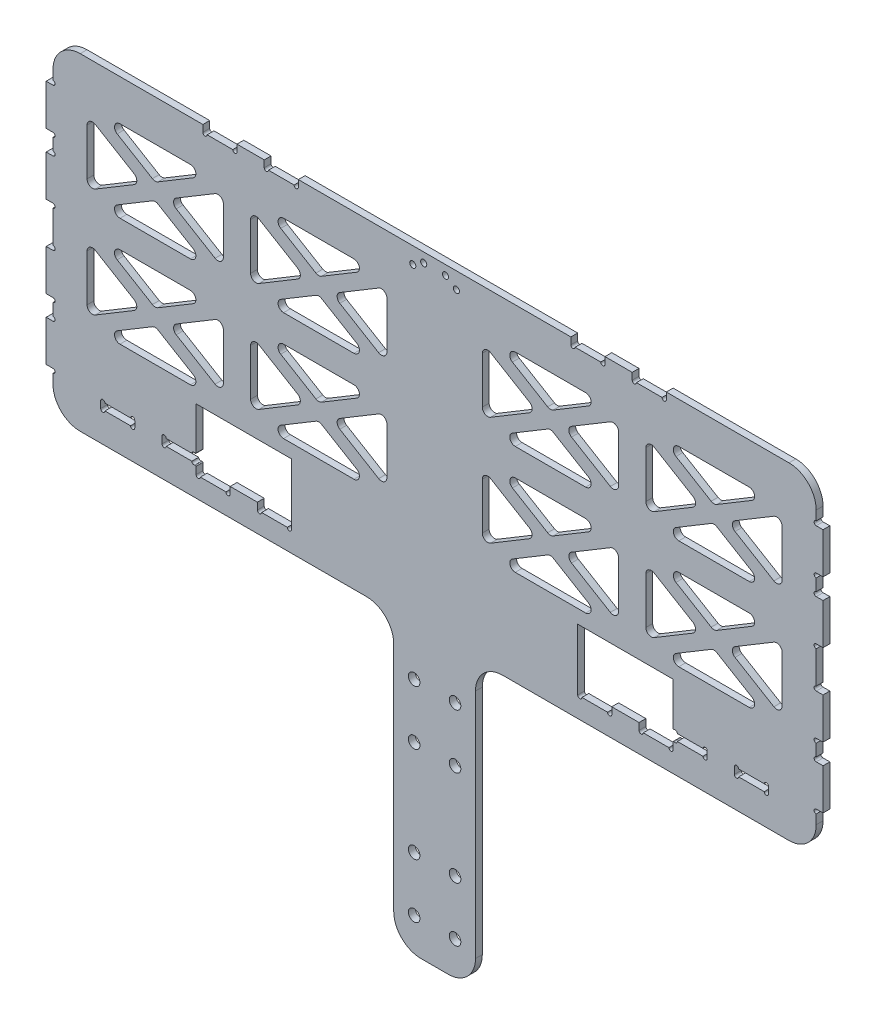
from build123d import *

# Parameters (mm, degrees)
EXTRUDE_1_DEPTH                = 5
SKETCH_2_R                     = 4.249999999999998
SKETCH_2_R_2                   = 4.249999999999999
CUT_EXTRUDE_1_DEPTH            = 26.000000000000004
FILLET_1_R                     = 20
SKETCH_3_W                     = 5.000000000000057
SKETCH_3_H                     = 30
SKETCH_3_H_2                   = 30.000000000000057
EXTRUDE_2_DEPTH                = 5
SKETCH_4_W                     = 70.00000000000001
SKETCH_4_H                     = 40.00000000000003
CUT_EXTRUDE_2_DEPTH            = 10
CUT_EXTRUDE_3_DEPTH            = 10
CUT_EXTRUDE_4_DEPTH            = 10
FILLET_2_R                     = 0.5
SKETCH_7_R                     = 2.2500000000000027
SKETCH_7_R_2                   = 2.2500000000000093
CUT_EXTRUDE_5_DEPTH            = 5
CUT_EXTRUDE_6_DEPTH            = 5
SKETCH_9_R                     = 1.5500000000000012
SKETCH_9_R_2                   = 1.5499999999999932
CUT_EXTRUDE_7_DEPTH            = 5
CUT_EXTRUDE_8_DEPTH            = 5
FILLET_3_R                     = 4
PATTERN_LINEAR_1_COUNT         = 2
PATTERN_LINEAR_1_PITCH         = 80
PATTERN_LINEAR_1_COUNT_DIR2    = 2
PATTERN_LINEAR_1_PITCH_DIR2    = 120
FILLET_3_OF_PATTERN_LINEAR_1_R = 4
MIRROR_1_DEPTH                 = 5


# Read off the part's stored shape, not the designer's step: 镜向1
with BuildPart() as part:
    # 草图1 → 凸台-拉伸1 (new body)
    with BuildSketch(Plane.XY):
        Polygon((-30, 0), (30, 0), (30, 210), (280, 210), (280, 449.99999999999994), (-280.0000000000001, 449.9999999999999), (-280, 210), (-30, 210), align=None)
    extrude(amount=EXTRUDE_1_DEPTH)

    # 草图2 → 切除-拉伸1 (cut)
    with BuildSketch(Plane.XY.offset(5)):
        with Locations((15, 25)):
            Circle(SKETCH_2_R)
        with Locations((15, 65)):
            Circle(SKETCH_2_R_2)
        with Locations((15, 135)):
            Circle(SKETCH_2_R_2)
        with Locations((15, 175.00000000000003)):
            Circle(SKETCH_2_R_2)
        with Locations(Location((-15, 175.00000000000003, 0), (0, 0, 180))):
            Circle(SKETCH_2_R_2)
        with Locations(Location((-15, 135, 0), (0, 0, 180))):
            Circle(SKETCH_2_R_2)
        with Locations(Location((-15, 65, 0), (0, 0, 180))):
            Circle(SKETCH_2_R_2)
        with Locations(Location((-15, 25, 0), (0, 0, 180))):
            Circle(SKETCH_2_R)
    extrude(amount=-CUT_EXTRUDE_1_DEPTH, mode=Mode.SUBTRACT)

    # 圆角1
    fillet_1_edges = [part.edges().sort_by_distance(p)[0] for p in [
        (30, 0, 2.5),
        (-30, 0, 2.5),
        (-30, 210, 2.5),
        (-280, 210, 2.5),
        (-280.0000000000001, 449.9999999999999, 2.5),
        (280, 449.99999999999994, 2.5),
        (280, 210, 2.5),
        (30, 210, 2.5),
    ]]
    fillet(fillet_1_edges, radius=FILLET_1_R)

    # 草图3 → 凸台-拉伸2 (add)
    with BuildSketch(Plane.XY.offset(5)):
        with Locations((282.5, 254.9999999999999)):
            Rectangle(SKETCH_3_W, SKETCH_3_H)
        with Locations((282.5, 299.99999999999994)):
            Rectangle(SKETCH_3_W, SKETCH_3_H)
        with Locations((282.5, 405)):
            Rectangle(SKETCH_3_W, SKETCH_3_H_2)
        with Locations((282.5, 360)):
            Rectangle(SKETCH_3_W, SKETCH_3_H)
        with Locations((-282.5, 360)):
            Rectangle(SKETCH_3_W, SKETCH_3_H)
        with Locations((-282.5, 405)):
            Rectangle(SKETCH_3_W, SKETCH_3_H_2)
        with Locations((-282.5, 254.9999999999999)):
            Rectangle(SKETCH_3_W, SKETCH_3_H)
        with Locations((-282.5, 299.99999999999994)):
            Rectangle(SKETCH_3_W, SKETCH_3_H)
    extrude(amount=-EXTRUDE_2_DEPTH)

    # 草图4 → 切除-拉伸2 (cut)
    with BuildSketch(Plane.XY.offset(5)):
        with Locations((140.00000000000006, 250)):
            Rectangle(SKETCH_4_W, SKETCH_4_H)
        with Locations((-140.00000000000006, 250)):
            Rectangle(SKETCH_4_W, SKETCH_4_H)
    extrude(amount=-CUT_EXTRUDE_2_DEPTH, mode=Mode.SUBTRACT)

    # 草图5 → 切除-拉伸3 (cut)
    with BuildSketch(Plane.XY.offset(5)):
        with BuildLine():
            Line((105.00000000000004, 229.99999999999997), (130.00000000000003, 229.99999999999997))
            Line((130.00000000000003, 229.99999999999997), (130.00000000000003, 224.99999999999997))
            ThreePointArc((130.00000000000003, 224.99999999999997), (128.45000000000005, 223.44999999999996), (126.90000000000003, 224.99999999999997))
            Line((126.90000000000003, 224.99999999999997), (108.10000000000002, 224.99999999999997))
            ThreePointArc((108.10000000000002, 224.99999999999997), (106.55000000000004, 223.45), (105.00000000000004, 224.99999999999997))
            Line((105.00000000000004, 224.99999999999997), (105.00000000000004, 229.99999999999997))
        make_face()
        with BuildLine():
            Line((150.00000000000006, 229.99999999999997), (175.00000000000006, 229.99999999999997))
            Line((175.00000000000006, 229.99999999999997), (175.00000000000006, 224.99999999999997))
            ThreePointArc((175.00000000000006, 224.99999999999997), (173.45000000000005, 223.45), (171.90000000000006, 224.99999999999997))
            Line((171.90000000000006, 224.99999999999997), (153.10000000000005, 224.99999999999997))
            ThreePointArc((153.10000000000005, 224.99999999999997), (151.55000000000004, 223.45), (150.00000000000006, 224.99999999999997))
            Line((150.00000000000006, 224.99999999999997), (150.00000000000006, 229.99999999999997))
        make_face()
        with BuildLine():
            Line((-175.00000000000006, 229.99999999999986), (-175.00000000000006, 224.99999999999986))
            ThreePointArc((-175.00000000000006, 224.99999999999986), (-173.45, 223.45), (-171.90000000000006, 224.99999999999997))
            Line((-171.90000000000006, 224.99999999999997), (-153.10000000000005, 224.99999999999997))
            ThreePointArc((-153.10000000000005, 224.99999999999997), (-151.5500000000001, 223.45), (-150.00000000000006, 224.99999999999986))
            Line((-150.00000000000006, 224.99999999999986), (-150.00000000000006, 229.99999999999986))
            Line((-150.00000000000006, 229.99999999999986), (-175.00000000000006, 229.99999999999986))
        make_face()
        with BuildLine():
            Line((-130.00000000000003, 229.99999999999986), (-130.00000000000003, 224.99999999999986))
            ThreePointArc((-130.00000000000003, 224.99999999999986), (-128.45, 223.44999999999996), (-126.90000000000003, 224.99999999999997))
            Line((-126.90000000000003, 224.99999999999997), (-108.10000000000002, 224.99999999999997))
            ThreePointArc((-108.10000000000002, 224.99999999999997), (-106.5500000000001, 223.45), (-105.00000000000004, 224.99999999999986))
            Line((-105.00000000000004, 224.99999999999986), (-105.00000000000004, 229.99999999999986))
            Line((-105.00000000000004, 229.99999999999986), (-130.00000000000003, 229.99999999999986))
        make_face()
    extrude(amount=-CUT_EXTRUDE_3_DEPTH, mode=Mode.SUBTRACT)

    # 草图6 → 切除-拉伸4 (cut)
    with BuildSketch(Plane.XY.offset(5)):
        with BuildLine():
            Line((178.10000000000002, 237), (196.90000000000003, 237))
            ThreePointArc((196.90000000000003, 237), (198.45000000000005, 238.54999999999998), (200.00000000000003, 237))
            Line((200.00000000000003, 237), (200.00000000000003, 231.99999999999997))
            ThreePointArc((200.00000000000003, 231.99999999999997), (198.45000000000005, 230.44999999999996), (196.90000000000003, 231.99999999999997))
            Line((196.90000000000003, 231.99999999999997), (178.10000000000002, 231.99999999999997))
            ThreePointArc((178.10000000000002, 231.99999999999997), (176.55000000000004, 230.45), (175.00000000000006, 231.99999999999997))
            Line((175.00000000000006, 231.99999999999997), (175.00000000000006, 237))
            ThreePointArc((175.00000000000006, 237), (176.55000000000004, 238.54999999999998), (178.10000000000002, 237))
        make_face()
        with BuildLine():
            Line((223.10000000000005, 237), (241.90000000000003, 237))
            ThreePointArc((241.90000000000003, 237), (243.45000000000002, 238.55000000000004), (245.00000000000006, 237))
            Line((245.00000000000006, 237), (245.00000000000006, 231.99999999999997))
            ThreePointArc((245.00000000000006, 231.99999999999997), (243.45000000000002, 230.45), (241.90000000000003, 231.99999999999997))
            Line((241.90000000000003, 231.99999999999997), (223.1, 231.99999999999997))
            ThreePointArc((223.1, 231.99999999999997), (221.54999999999998, 230.45000000000005), (220.00000000000006, 231.99999999999997))
            Line((220.00000000000006, 231.99999999999997), (220.00000000000006, 237))
            ThreePointArc((220.00000000000006, 237), (221.55000000000004, 238.55), (223.10000000000005, 237))
        make_face()
        with BuildLine():
            Line((-245.00000000000006, 237), (-245.00000000000006, 231.99999999999997))
            ThreePointArc((-245.00000000000006, 231.99999999999997), (-243.45000000000002, 230.45), (-241.90000000000003, 231.99999999999997))
            Line((-241.90000000000003, 231.99999999999997), (-223.1, 231.99999999999997))
            ThreePointArc((-223.1, 231.99999999999997), (-221.54999999999998, 230.45000000000005), (-220.00000000000006, 231.99999999999997))
            Line((-220.00000000000006, 231.99999999999997), (-220.00000000000006, 237))
            ThreePointArc((-220.00000000000006, 237), (-221.55000000000004, 238.55), (-223.10000000000005, 237))
            Line((-223.10000000000005, 237), (-241.90000000000003, 237))
            ThreePointArc((-241.90000000000003, 237), (-243.45000000000002, 238.55000000000004), (-245.00000000000006, 237))
        make_face()
        with BuildLine():
            Line((-200.00000000000003, 237), (-200.00000000000003, 231.99999999999997))
            ThreePointArc((-200.00000000000003, 231.99999999999997), (-198.45000000000005, 230.44999999999996), (-196.90000000000003, 231.99999999999997))
            Line((-196.90000000000003, 231.99999999999997), (-178.10000000000002, 231.99999999999997))
            ThreePointArc((-178.10000000000002, 231.99999999999997), (-176.55000000000004, 230.45), (-175.00000000000006, 231.99999999999997))
            Line((-175.00000000000006, 231.99999999999997), (-175.00000000000006, 237))
            ThreePointArc((-175.00000000000006, 237), (-176.55000000000004, 238.54999999999998), (-178.10000000000002, 237))
            Line((-178.10000000000002, 237), (-196.90000000000003, 237))
            ThreePointArc((-196.90000000000003, 237), (-198.45000000000005, 238.54999999999998), (-200.00000000000003, 237))
        make_face()
    extrude(amount=-CUT_EXTRUDE_4_DEPTH, mode=Mode.SUBTRACT)

    # 圆角2
    fillet_2_edges = [part.edges().sort_by_distance(p)[0] for p in [
        (175.00000000000006, 231.99999999999997, 2.5),
        (175.00000000000006, 237, 2.5),
        (-175.00000000000006, 231.99999999999997, 2.5),
        (-175.00000000000006, 237, 2.5),
    ]]
    fillet(fillet_2_edges, radius=FILLET_2_R)

    # 草图7 → 切除-拉伸5 (cut)
    with BuildSketch(Plane.XY.offset(5)):
        with Locations((8.000000000000007, 442.99999999999994)):
            Circle(SKETCH_7_R)
        with Locations((16.000000000000007, 437.99999999999994)):
            Circle(SKETCH_7_R_2)
        with Locations((-16.000000000000007, 437.99999999999994)):
            Circle(SKETCH_7_R_2)
        with Locations((-8.000000000000007, 442.99999999999994)):
            Circle(SKETCH_7_R)
    extrude(amount=-CUT_EXTRUDE_5_DEPTH, mode=Mode.SUBTRACT)

    # 草图8 → 切除-拉伸6 (cut)
    with BuildSketch(Plane.XY.offset(5)):
        with BuildLine():
            Line((100, 449.99999999999994), (125, 449.99999999999994))
            Line((125, 449.99999999999994), (125, 444.99999999999994))
            ThreePointArc((125, 444.99999999999994), (123.45, 443.44999999999993), (121.9, 444.99999999999994))
            Line((121.9, 444.99999999999994), (103.1, 444.99999999999994))
            ThreePointArc((103.1, 444.99999999999994), (101.55, 443.44999999999993), (100, 444.99999999999994))
            Line((100, 444.99999999999994), (100, 449.99999999999994))
        make_face()
        with BuildLine():
            Line((-169.99999999999997, 449.9999999999997), (-169.99999999999994, 444.9999999999997))
            ThreePointArc((-169.99999999999994, 444.9999999999997), (-168.45000000000002, 443.4499999999997), (-166.90000000000003, 444.9999999999997))
            Line((-166.90000000000003, 444.9999999999997), (-148.10000000000002, 444.9999999999997))
            ThreePointArc((-148.10000000000002, 444.9999999999997), (-146.55, 443.4499999999997), (-144.99999999999997, 444.9999999999997))
            Line((-144.99999999999997, 444.9999999999997), (-144.99999999999997, 449.9999999999997))
            Line((-144.99999999999997, 449.9999999999997), (-169.99999999999997, 449.9999999999997))
        make_face()
        with BuildLine():
            Line((144.99999999999997, 449.99999999999994), (169.99999999999997, 449.99999999999994))
            Line((169.99999999999997, 449.99999999999994), (169.99999999999994, 444.99999999999994))
            ThreePointArc((169.99999999999994, 444.99999999999994), (168.45000000000002, 443.44999999999993), (166.90000000000003, 444.99999999999994))
            Line((166.90000000000003, 444.99999999999994), (148.10000000000002, 444.99999999999994))
            ThreePointArc((148.10000000000002, 444.99999999999994), (146.55, 443.44999999999993), (144.99999999999997, 444.99999999999994))
            Line((144.99999999999997, 444.99999999999994), (144.99999999999997, 449.99999999999994))
        make_face()
        with BuildLine():
            Line((-125, 449.9999999999997), (-125, 444.9999999999997))
            ThreePointArc((-125, 444.9999999999997), (-123.45, 443.4499999999997), (-121.9, 444.9999999999997))
            Line((-121.9, 444.9999999999997), (-103.1, 444.9999999999997))
            ThreePointArc((-103.1, 444.9999999999997), (-101.55, 443.4499999999997), (-100, 444.9999999999997))
            Line((-100, 444.9999999999997), (-100, 449.9999999999997))
            Line((-100, 449.9999999999997), (-125, 449.9999999999997))
        make_face()
    extrude(amount=-CUT_EXTRUDE_6_DEPTH, mode=Mode.SUBTRACT)

    # 草图9 → 切除-拉伸7 (cut)
    with BuildSketch(Plane.XY.offset(5)):
        with Locations((280, 421.55)):
            Circle(SKETCH_9_R)
        with Locations((280, 388.45)):
            Circle(SKETCH_9_R)
        with Locations((280, 376.55)):
            Circle(SKETCH_9_R)
        with Locations((280, 343.44999999999993)):
            Circle(SKETCH_9_R)
        with Locations((280, 316.54999999999995)):
            Circle(SKETCH_9_R)
        with Locations((280, 283.44999999999993)):
            Circle(SKETCH_9_R)
        with Locations((280, 271.5499999999999)):
            Circle(SKETCH_9_R)
        with Locations((280, 238.44999999999987)):
            Circle(SKETCH_9_R_2)
        with Locations((-280, 238.44999999999987)):
            Circle(SKETCH_9_R_2)
        with Locations((-280, 271.5499999999999)):
            Circle(SKETCH_9_R)
        with Locations((-280, 283.44999999999993)):
            Circle(SKETCH_9_R)
        with Locations((-280, 316.54999999999995)):
            Circle(SKETCH_9_R)
        with Locations((-280, 343.44999999999993)):
            Circle(SKETCH_9_R)
        with Locations((-280, 376.55)):
            Circle(SKETCH_9_R)
        with Locations((-280, 388.45)):
            Circle(SKETCH_9_R)
        with Locations((-280, 421.55)):
            Circle(SKETCH_9_R)
    extrude(amount=-CUT_EXTRUDE_7_DEPTH, mode=Mode.SUBTRACT)

    # 草图10 → 切除-拉伸8 (cut)
    with BuildSketch(Plane.XY.offset(5)):
        Polygon((-245.28174684192453, 419.9999999999997), (-164.71825315807547, 419.9999999999997), (-205.00000000000006, 395.83095189484504), align=None)
        Polygon((-255, 414.16904810515445), (-255, 365.83095189484504), (-214.7182531580755, 389.9999999999997), align=None)
        Polygon((-245.28174684192453, 359.9999999999998), (-164.71825315807553, 359.9999999999998), (-205.00000000000003, 384.16904810515445), align=None)
        Polygon((-154.99999999999997, 414.16904810515445), (-155.00000000000003, 365.830951894845), (-195.28174684192456, 389.9999999999997), align=None)
    cut_extrude_8 = extrude(amount=-CUT_EXTRUDE_8_DEPTH, mode=Mode.SUBTRACT)

    # 圆角3
    fillet_3_edges = [part.edges().sort_by_distance(p)[0] for p in [
        (-164.71825315807553, 359.9999999999998, 2.5),
        (-205.00000000000003, 384.16904810515445, 2.5),
        (-245.28174684192453, 359.9999999999998, 2.5),
        (-255, 365.83095189484504, 2.5),
        (-214.7182531580755, 389.9999999999997, 2.5),
        (-255, 414.16904810515445, 2.5),
        (-154.99999999999997, 414.16904810515445, 2.5),
        (-195.28174684192456, 389.9999999999997, 2.5),
        (-155.00000000000003, 365.830951894845, 2.5),
        (-164.71825315807547, 419.9999999999997, 2.5),
        (-245.28174684192453, 419.9999999999997, 2.5),
        (-205.00000000000006, 395.83095189484504, 2.5),
    ]]
    fillet(fillet_3_edges, radius=FILLET_3_R)

    # 阵列(线性)1: Cut-Extrude 8 2 × 2
    with Locations(*[(j * PATTERN_LINEAR_1_PITCH_DIR2, -i * PATTERN_LINEAR_1_PITCH, 0) for i in range(PATTERN_LINEAR_1_COUNT) for j in range(PATTERN_LINEAR_1_COUNT_DIR2) if (i, j) != (0, 0)]):
        add(cut_extrude_8, mode=Mode.SUBTRACT)

    # 圆角3 of 阵列(线性)1
    fillet_3_of_pattern_linear_1_edges = [part.edges().sort_by_distance(p)[0] for p in [
        (-44.71825315807553, 359.99999999999955, 2.5),
        (-85.00000000000003, 384.1690481051542, 2.5),
        (-125.28174684192453, 359.99999999999955, 2.5),
        (-135, 365.8309518948448, 2.5),
        (-94.7182531580755, 389.9999999999995, 2.5),
        (-135, 414.1690481051542, 2.5),
        (-34.99999999999997, 414.1690481051542, 2.5),
        (-75.28174684192456, 389.9999999999995, 2.5),
        (-35.00000000000003, 365.83095189484476, 2.5),
        (-44.71825315807547, 419.9999999999995, 2.5),
        (-125.28174684192453, 419.9999999999995, 2.5),
        (-85.00000000000006, 395.8309518948448, 2.5),
        (-164.71825315807553, 279.9999999999998, 2.5),
        (-205.00000000000003, 304.16904810515445, 2.5),
        (-245.28174684192453, 279.9999999999998, 2.5),
        (-255, 285.83095189484504, 2.5),
        (-214.7182531580755, 309.9999999999997, 2.5),
        (-255, 334.16904810515445, 2.5),
        (-154.99999999999997, 334.16904810515445, 2.5),
        (-195.28174684192456, 309.9999999999997, 2.5),
        (-155.00000000000003, 285.830951894845, 2.5),
        (-164.71825315807547, 339.9999999999997, 2.5),
        (-245.28174684192453, 339.9999999999997, 2.5),
        (-205.00000000000006, 315.83095189484504, 2.5),
        (-44.71825315807553, 279.99999999999955, 2.5),
        (-85.00000000000003, 304.1690481051542, 2.5),
        (-125.28174684192453, 279.99999999999955, 2.5),
        (-135, 285.8309518948448, 2.5),
        (-94.7182531580755, 309.9999999999995, 2.5),
        (-135, 334.1690481051542, 2.5),
        (-34.99999999999997, 334.1690481051542, 2.5),
        (-75.28174684192456, 309.9999999999995, 2.5),
        (-35.00000000000003, 285.83095189484476, 2.5),
        (-44.71825315807547, 339.9999999999995, 2.5),
        (-125.28174684192453, 339.9999999999995, 2.5),
        (-85.00000000000006, 315.8309518948448, 2.5),
    ]]
    fillet(fillet_3_of_pattern_linear_1_edges, radius=FILLET_3_OF_PATTERN_LINEAR_1_R)

    # 镜向1 outline → 镜向1 (cut)
    with BuildSketch(Plane.XY):
        with BuildLine():
            Line((179.159522351, 280), (230.840477649, 280))
            ThreePointArc((230.840477649, 280), (234.695337362, 282.932265672), (232.898460671, 287.429971703))
            Line((232.898460671, 287.429971703), (207.057983022, 302.934258292))
            ThreePointArc((207.057983022, 302.934258292), (205, 303.504286589), (202.942016978, 302.934258292))
            Line((202.942016978, 302.934258292), (177.101539329, 287.429971703))
            ThreePointArc((177.101539329, 287.429971703), (175.304662638, 282.932265672), (179.159522351, 280))
        make_face()
        with BuildLine():
            Line((59.159522351, 280), (110.840477649, 280))
            ThreePointArc((110.840477649, 280), (114.695337362, 282.932265672), (112.898460671, 287.429971703))
            Line((112.898460671, 287.429971703), (87.057983022, 302.934258292))
            ThreePointArc((87.057983022, 302.934258292), (85, 303.504286589), (82.942016978, 302.934258292))
            Line((82.942016978, 302.934258292), (57.101539329, 287.429971703))
            ThreePointArc((57.101539329, 287.429971703), (55.304662638, 282.932265672), (59.159522351, 280))
        make_face()
        with BuildLine():
            Line((179.159522351, 360), (230.840477649, 360))
            ThreePointArc((230.840477649, 360), (234.695337362, 362.932265672), (232.898460671, 367.429971703))
            Line((232.898460671, 367.429971703), (207.057983022, 382.934258292))
            ThreePointArc((207.057983022, 382.934258292), (205, 383.504286589), (202.942016978, 382.934258292))
            Line((202.942016978, 382.934258292), (177.101539329, 367.429971703))
            ThreePointArc((177.101539329, 367.429971703), (175.304662638, 362.932265672), (179.159522351, 360))
        make_face()
        with BuildLine():
            Line((59.159522351, 360), (110.840477649, 360))
            ThreePointArc((110.840477649, 360), (114.695337362, 362.932265672), (112.898460671, 367.429971703))
            Line((112.898460671, 367.429971703), (87.057983022, 382.934258292))
            ThreePointArc((87.057983022, 382.934258292), (85, 383.504286589), (82.942016978, 382.934258292))
            Line((82.942016978, 382.934258292), (57.101539329, 367.429971703))
            ThreePointArc((57.101539329, 367.429971703), (55.304662638, 362.932265672), (59.159522351, 360))
        make_face()
        with BuildLine():
            Line((110.840477649, 340), (59.159522351, 340))
            ThreePointArc((59.159522351, 340), (55.304662638, 337.067734328), (57.101539329, 332.570028297))
            Line((57.101539329, 332.570028297), (82.942016978, 317.065741708))
            ThreePointArc((82.942016978, 317.065741708), (85, 316.495713411), (87.057983022, 317.065741708))
            Line((87.057983022, 317.065741708), (112.898460671, 332.570028297))
            ThreePointArc((112.898460671, 332.570028297), (114.695337362, 337.067734328), (110.840477649, 340))
        make_face()
        with BuildLine():
            Line((230.840477649, 340), (179.159522351, 340))
            ThreePointArc((179.159522351, 340), (175.304662638, 337.067734328), (177.101539329, 332.570028297))
            Line((177.101539329, 332.570028297), (202.942016978, 317.065741708))
            ThreePointArc((202.942016978, 317.065741708), (205, 316.495713411), (207.057983022, 317.065741708))
            Line((207.057983022, 317.065741708), (232.898460671, 332.570028297))
            ThreePointArc((232.898460671, 332.570028297), (234.695337362, 337.067734328), (230.840477649, 340))
        make_face()
        with BuildLine():
            Line((230.840477649, 420), (179.159522351, 420))
            ThreePointArc((179.159522351, 420), (175.304662638, 417.067734328), (177.101539329, 412.570028297))
            Line((177.101539329, 412.570028297), (202.942016978, 397.065741708))
            ThreePointArc((202.942016978, 397.065741708), (205, 396.495713411), (207.057983022, 397.065741708))
            Line((207.057983022, 397.065741708), (232.898460671, 412.570028297))
            ThreePointArc((232.898460671, 412.570028297), (234.695337362, 417.067734328), (230.840477649, 420))
        make_face()
        with BuildLine():
            Line((110.840477649, 420), (59.159522351, 420))
            ThreePointArc((59.159522351, 420), (55.304662638, 417.067734328), (57.101539329, 412.570028297))
            Line((57.101539329, 412.570028297), (82.942016978, 397.065741708))
            ThreePointArc((82.942016978, 397.065741708), (85, 396.495713411), (87.057983022, 397.065741708))
            Line((87.057983022, 397.065741708), (112.898460671, 412.570028297))
            ThreePointArc((112.898460671, 412.570028297), (114.695337362, 417.067734328), (110.840477649, 420))
        make_face()
        with BuildLine():
            Line((161.057983022, 369.465741708), (189.565127337, 386.570028297))
            ThreePointArc((189.565127337, 386.570028297), (191.507144315, 390), (189.565127337, 393.429971703))
            Line((189.565127337, 393.429971703), (161.057983022, 410.534258292))
            ThreePointArc((161.057983022, 410.534258292), (157.02920474, 410.585086216), (155, 407.104286589))
            Line((155, 407.104286589), (155, 372.895713411))
            ThreePointArc((155, 372.895713411), (157.02920474, 369.414913784), (161.057983022, 369.465741708))
        make_face()
        with BuildLine():
            Line((220.434872663, 386.570028297), (248.942016978, 369.465741708))
            ThreePointArc((248.942016978, 369.465741708), (252.97079526, 369.414913784), (255, 372.895713411))
            Line((255, 372.895713411), (255, 407.104286589))
            ThreePointArc((255, 407.104286589), (252.97079526, 410.585086216), (248.942016978, 410.534258292))
            Line((248.942016978, 410.534258292), (220.434872663, 393.429971703))
            ThreePointArc((220.434872663, 393.429971703), (218.492855685, 390), (220.434872663, 386.570028297))
        make_face()
        with BuildLine():
            Line((41.057983022, 289.465741708), (69.565127337, 306.570028297))
            ThreePointArc((69.565127337, 306.570028297), (71.507144315, 310), (69.565127337, 313.429971703))
            Line((69.565127337, 313.429971703), (41.057983022, 330.534258292))
            ThreePointArc((41.057983022, 330.534258292), (37.02920474, 330.585086216), (35, 327.104286589))
            Line((35, 327.104286589), (35, 292.895713411))
            ThreePointArc((35, 292.895713411), (37.02920474, 289.414913784), (41.057983022, 289.465741708))
        make_face()
        with BuildLine():
            Line((100.434872663, 306.570028297), (128.942016978, 289.465741708))
            ThreePointArc((128.942016978, 289.465741708), (132.97079526, 289.414913784), (135, 292.895713411))
            Line((135, 292.895713411), (135, 327.104286589))
            ThreePointArc((135, 327.104286589), (132.97079526, 330.585086216), (128.942016978, 330.534258292))
            Line((128.942016978, 330.534258292), (100.434872663, 313.429971703))
            ThreePointArc((100.434872663, 313.429971703), (98.492855685, 310), (100.434872663, 306.570028297))
        make_face()
        with BuildLine():
            Line((161.057983022, 289.465741708), (189.565127337, 306.570028297))
            ThreePointArc((189.565127337, 306.570028297), (191.507144315, 310), (189.565127337, 313.429971703))
            Line((189.565127337, 313.429971703), (161.057983022, 330.534258292))
            ThreePointArc((161.057983022, 330.534258292), (157.02920474, 330.585086216), (155, 327.104286589))
            Line((155, 327.104286589), (155, 292.895713411))
            ThreePointArc((155, 292.895713411), (157.02920474, 289.414913784), (161.057983022, 289.465741708))
        make_face()
        with BuildLine():
            Line((248.942016978, 330.534258292), (220.434872663, 313.429971703))
            ThreePointArc((220.434872663, 313.429971703), (218.492855685, 310), (220.434872663, 306.570028297))
            Line((220.434872663, 306.570028297), (248.942016978, 289.465741708))
            ThreePointArc((248.942016978, 289.465741708), (252.97079526, 289.414913784), (255, 292.895713411))
            Line((255, 292.895713411), (255, 327.104286589))
            ThreePointArc((255, 327.104286589), (252.97079526, 330.585086216), (248.942016978, 330.534258292))
        make_face()
        with BuildLine():
            Line((35, 407.104286589), (35, 372.895713411))
            ThreePointArc((35, 372.895713411), (37.02920474, 369.414913784), (41.057983022, 369.465741708))
            Line((41.057983022, 369.465741708), (69.565127337, 386.570028297))
            ThreePointArc((69.565127337, 386.570028297), (71.507144315, 390), (69.565127337, 393.429971703))
            Line((69.565127337, 393.429971703), (41.057983022, 410.534258292))
            ThreePointArc((41.057983022, 410.534258292), (37.02920474, 410.585086216), (35, 407.104286589))
        make_face()
        with BuildLine():
            Line((135, 372.895713411), (135, 407.104286589))
            ThreePointArc((135, 407.104286589), (132.97079526, 410.585086216), (128.942016978, 410.534258292))
            Line((128.942016978, 410.534258292), (100.434872663, 393.429971703))
            ThreePointArc((100.434872663, 393.429971703), (98.492855685, 390), (100.434872663, 386.570028297))
            Line((100.434872663, 386.570028297), (128.942016978, 369.465741708))
            ThreePointArc((128.942016978, 369.465741708), (132.97079526, 369.414913784), (135, 372.895713411))
        make_face()
    extrude(amount=MIRROR_1_DEPTH, mode=Mode.SUBTRACT)


solid = part.part
